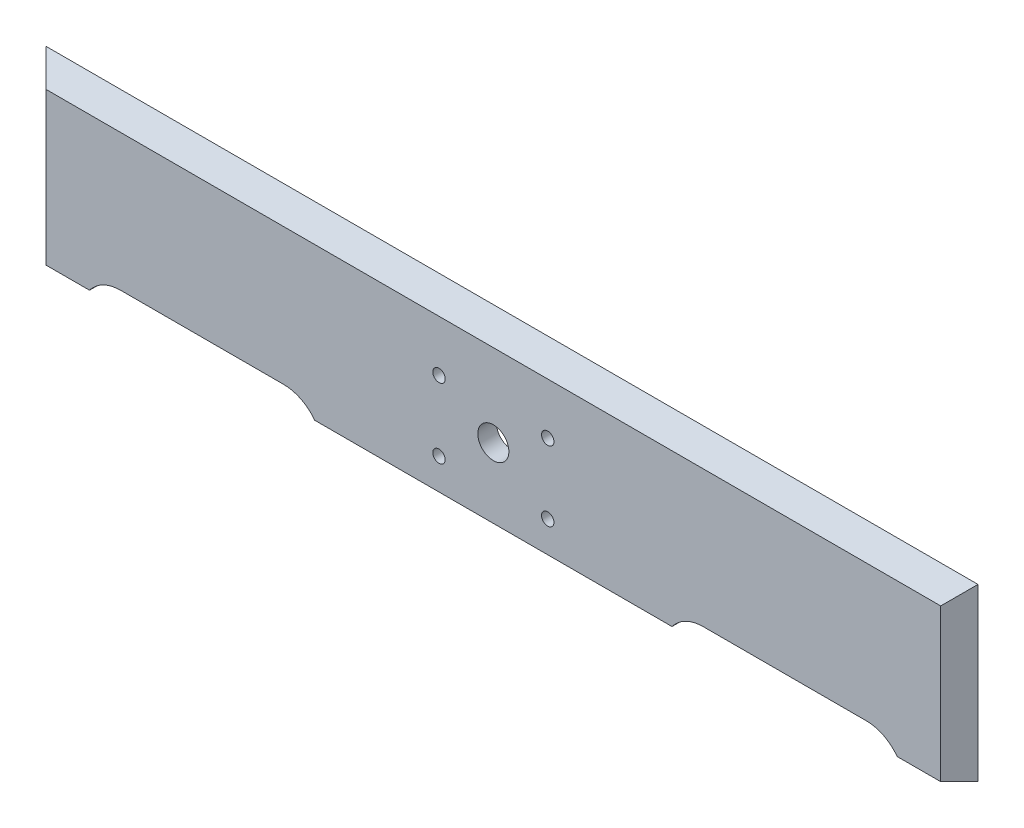
from build123d import *

# Parameters (mm, degrees)
BOSS_EXTRUDE1_DEPTH = 12
CHAMFER1_SIZE       = 12
SKETCH2_R           = 4
SKETCH2_R_2         = 10
CUT_EXTRUDE1_DEPTH  = 609.394608786


with BuildPart() as part:
    # Sketch1 → Boss-Extrude1 (new body)
    with BuildSketch(Plane.XY):
        with BuildLine():
            Line((0, 0), (0, -10))
            Line((0, -10), (40, -10))
            ThreePointArc((40, -10), (48.819660113, -2.639320225), (60, 0))
            Line((60, 0), (165, 0))
            ThreePointArc((165, 0), (176.180339887, -2.639320225), (185, -10))
            Line((185, -10), (415, -10))
            ThreePointArc((415, -10), (423.819660113, -2.639320225), (435, 0))
            Line((435, 0), (540, 0))
            ThreePointArc((540, 0), (551.180339887, -2.639320225), (560, -10))
            Line((560, -10), (600, -10))
            Line((600, -10), (600, 0))
            Line((600, 0), (600, 100))
            Line((600, 100), (0, 100))
            Line((0, 100), (0, 0))
        make_face()
    extrude(amount=BOSS_EXTRUDE1_DEPTH)

    # Chamfer1
    chamfer1_edges = [part.edges().sort_by_distance(p)[0] for p in [
        (300, 100, 12),
        (600, 45, 12),
        (0, 45, 12),
    ]]
    chamfer(chamfer1_edges, length=CHAMFER1_SIZE - 0.0001)  # a hair under: the kernel refuses the full size

    # Sketch2 → Cut-Extrude1 (cut, through all)
    with BuildSketch(Plane(origin=(0, 0, 0), x_dir=(-1, 0, 0), z_dir=(0, 0, -1))):
        with Locations((-335, 55)):
            Circle(SKETCH2_R)
        with Locations((-300, 35)):
            Circle(SKETCH2_R_2)
        with Locations((-265, 55)):
            Circle(SKETCH2_R)
        with Locations((-335, 10)):
            Circle(SKETCH2_R)
        with Locations((-265, 10)):
            Circle(SKETCH2_R)
    extrude(amount=-CUT_EXTRUDE1_DEPTH, mode=Mode.SUBTRACT)


solid = part.part
